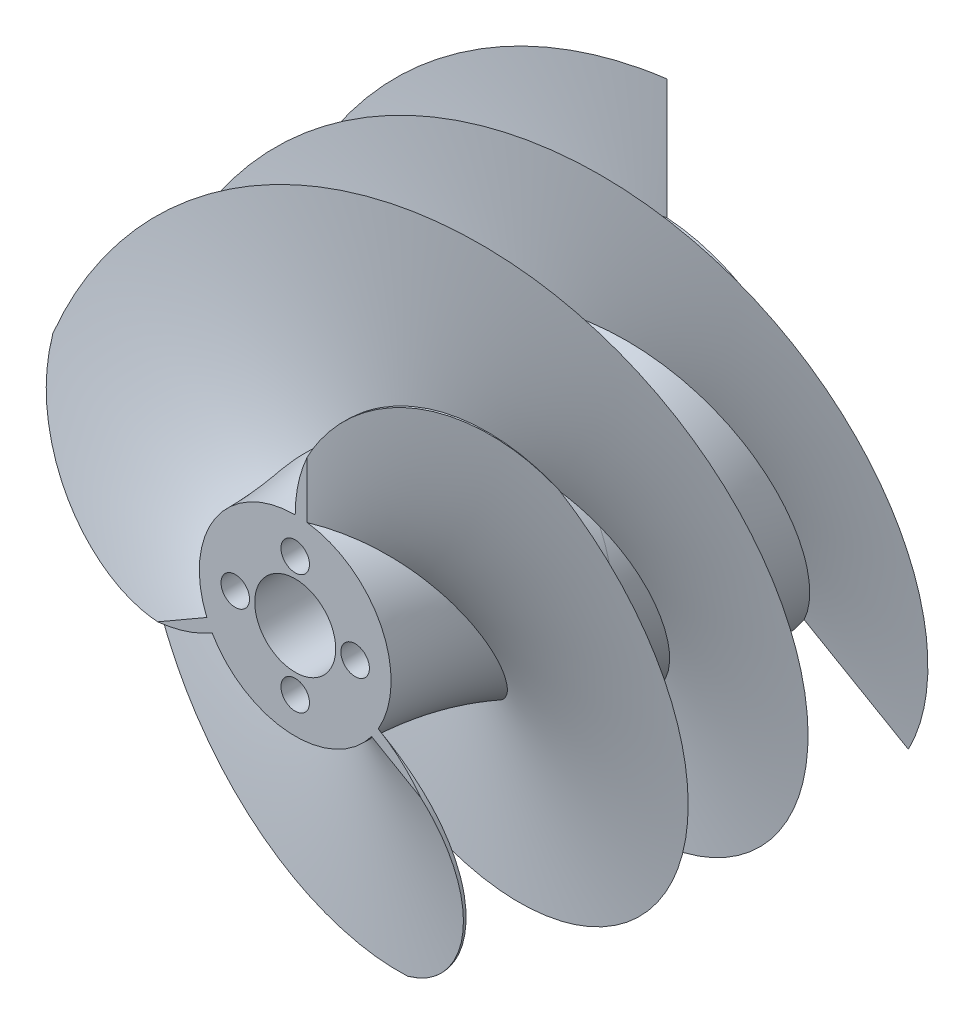
from build123d import *
from build123d.topology import SkipClean

# Parameters (mm, degrees)
SWEEP2_PITCH       = 30
CUT_EXTRUDE1_DEPTH = 10
CIRPATTERN4_COUNT  = 3
SKETCH7_R          = 1.190625
CUT_EXTRUDE2_DEPTH = 47.389654192


with BuildPart() as part:
    # Sketch2 → Revolve1 (revolve)
    with BuildSketch(Plane.YZ, mode=Mode.PRIVATE) as revolve1_sk:
        with BuildLine():
            Line((-3.3782, 0), (-3.3782, 30))
            Line((-3.3782, 30), (-8, 30))
            ThreePointArc((-8, 30), (-8.886596141, 22.2985391), (-11.5, 15))
            ThreePointArc((-11.5, 15), (-14.113403859, 7.7014609), (-15, 0))
            Line((-15, 0), (-3.3782, 0))
        make_face()
    revolve(revolve1_sk.sketch.rotate(Axis((0, 0, 31.5), (0, 0, -1)), 270), axis=Axis((0, 0, 31.5), (0, 0, -1)))

    # Sweep2: arcs per turn and ends read off the stored shape
    # Sweep2: the profile of Sketch4 screwed along a right-hand helix through 1 turns, 22 arcs to a turn; built about Z, then put on its axis
    sweep2_z = Axis((0, 0, 0), (0, 0, 1))
    sweep2_corners = [(25, 1, 0), (3.3782, 1, 0), (3.3782, 0, 0), (18.755002002, 0, 0)]
    with BuildLine(mode=Mode.PRIVATE) as sweep2_profile:
        Line(sweep2_corners[0], sweep2_corners[1])
        Line(sweep2_corners[1], sweep2_corners[2])
        Line(sweep2_corners[2], sweep2_corners[3])
        ThreePointArc((18.755002002, 0, 0), (21.917279662, 0.251582342, 0), (25, 1, 0))
    sweep2_cap = Face(sweep2_profile.wire())
    sweep2_arcs = [((18.755002002, 0, 0), (21.957565078, 0, 0), (25, 1, 0), (1, 0.9874208829065753, 1))]  # start, shoulder, end, weights
    sweep2_turn_angles = [0, 8.181818182, 16.363636364, 24.545454545, 32.727272727, 40.909090909, 49.090909091, 57.272727273, 65.454545455, 73.636363636, 81.818181818, 90, 98.181818182, 106.363636364, 114.545454545, 122.727272727, 130.909090909, 139.090909091, 147.272727273, 155.454545455, 163.636363636, 171.818181818, 180, 188.181818182, 196.363636364, 204.545454545, 212.727272727, 220.909090909, 229.090909091, 237.272727273, 245.454545455, 253.636363636, 261.818181818, 270, 278.181818182, 286.363636364, 294.545454545, 302.727272727, 310.909090909, 319.090909091, 327.272727273, 335.454545455, 343.636363636, 351.818181818, 360]
    sweep2_turn_weights = [1, 0.9898214418809327, 1, 0.9898214418809327, 1, 0.9898214418809327, 1, 0.9898214418809327, 1, 0.9898214418809327, 1, 0.9898214418809327, 1, 0.9898214418809327, 1, 0.9898214418809327, 1, 0.9898214418809327, 1, 0.9898214418809328, 1, 0.9898214418809327, 1, 0.9898214418809327, 1, 0.9898214418809328, 1, 0.9898214418809327, 1, 0.9898214418809328, 1, 0.9898214418809327, 1, 0.9898214418809327, 1, 0.9898214418809327, 1, 0.9898214418809328, 1, 0.9898214418809327, 1, 0.9898214418809327, 1, 0.9898214418809327, 1]
    sweep2_turn_rails = [Edge.make_bspline([Vector(p[0], p[1], 0).rotate(sweep2_z, sweep2_turn_angles[k]) / sweep2_turn_weights[k] + Vector(0, 0, p[2] + SWEEP2_PITCH * sweep2_turn_angles[k] / 360) for k in range(45)], [0, 0, 0, 1, 1, 2, 2, 3, 3, 4, 4, 5, 5, 6, 6, 7, 7, 8, 8, 9, 9, 10, 10, 11, 11, 12, 12, 13, 13, 14, 14, 15, 15, 16, 16, 17, 17, 18, 18, 19, 19, 20, 20, 21, 21, 22, 22, 22], 2, sweep2_turn_weights) for p in sweep2_corners]
    sweep2_turn_sides = [*[Face.make_surface_from_curves(sweep2_turn_rails[p[0]], sweep2_turn_rails[p[1]]) for p in [(0, 1), (1, 2), (2, 3)]], *[Face.make_bezier_surface([[Vector(p[j][0], p[j][1], 0).rotate(sweep2_z, sweep2_turn_angles[2 * i + k]) / sweep2_turn_weights[2 * i + k] + Vector(0, 0, p[j][2] + SWEEP2_PITCH * sweep2_turn_angles[2 * i + k] / 360) for k in range(3)] for j in range(3)], [[p[3][j] * sweep2_turn_weights[2 * i + k] for k in range(3)] for j in range(3)]) for p in sweep2_arcs for i in range(22)]]
    sweep2 = Plane(origin=(0, 0, 30), x_dir=(0, 1, 0), z_dir=(0, 0, -1)) * Solid(Shell([*sweep2_turn_sides, sweep2_cap, sweep2_cap.rotate(sweep2_z, 360).moved(Location((0, 0, SWEEP2_PITCH * 360 / 360)))]))
    add(sweep2)

    # Sketch6 → Cut-Extrude1 (cut)
    with BuildSketch(Plane.XY.offset(30)):
        with BuildLine():
            Line((0, 8), (-28.91366459, 8))
            ThreePointArc((-28.91366459, 8), (-7.201723606, 29.122760465), (21.852609778, 20.553915585))
            Line((21.852609778, 20.553915585), (18.210508148, 17.128262988))
            ThreePointArc((18.210508148, 17.128262988), (6.287650865, 18.185133679), (0, 8))
        make_face()
    extrude(amount=-CUT_EXTRUDE1_DEPTH, mode=Mode.SUBTRACT)


with BuildPart() as cirpattern4_1:
    # CirPattern4: pattern copy
    add(part.part.rotate(Axis((0, 0, 31.5), (0, 0, -1)), 1 * 360 / CIRPATTERN4_COUNT))


with BuildPart() as cirpattern4_2:
    # CirPattern4: pattern copy
    add(part.part.rotate(Axis((0, 0, 31.5), (0, 0, -1)), 2 * 360 / CIRPATTERN4_COUNT))


with BuildPart() as part_1:
    with SkipClean():  # the faces are left unmerged after this step: merging them gives an invalid solid
        add(part.part)

        add(cirpattern4_1.part)  # Revolve3 merges CirPattern4_1

        add(cirpattern4_2.part)  # Revolve3 merges CirPattern4_2
        # Sketch2<3> → Revolve3 (revolve)
        with BuildSketch(Plane.YZ):
            with BuildLine():
                Line((-3.3782, 0), (-3.3782, 30))
                Line((-3.3782, 30), (-8, 30))
                ThreePointArc((-8, 30), (-8.886596141, 22.2985391), (-11.5, 15))
                ThreePointArc((-11.5, 15), (-14.113403859, 7.7014609), (-15, 0))
                Line((-15, 0), (-3.3782, 0))
            make_face()
        revolve(axis=Axis((0, 0, 31.5), (0, 0, -1)))

    # Sketch7 → Cut-Extrude2 (cut, through all)
    with SkipClean():  # the faces are left unmerged after this step: merging them gives an invalid solid
        with BuildSketch(Plane(origin=(0, 0, 0), x_dir=(1, 0, 0), z_dir=(0, 0, -1))):
            with Locations(Location((0, 5, 0), (0, 0, 180))):
                Circle(SKETCH7_R)
            with Locations(Location((5, 0, 0), (0, 0, 180))):
                Circle(SKETCH7_R)
            with Locations(Location((0, -5, 0), (0, 0, 180))):
                Circle(SKETCH7_R)
            with Locations(Location((-5, 0, 0), (0, 0, 180))):
                Circle(SKETCH7_R)
        extrude(amount=-CUT_EXTRUDE2_DEPTH, mode=Mode.SUBTRACT)


solid = part_1.part
